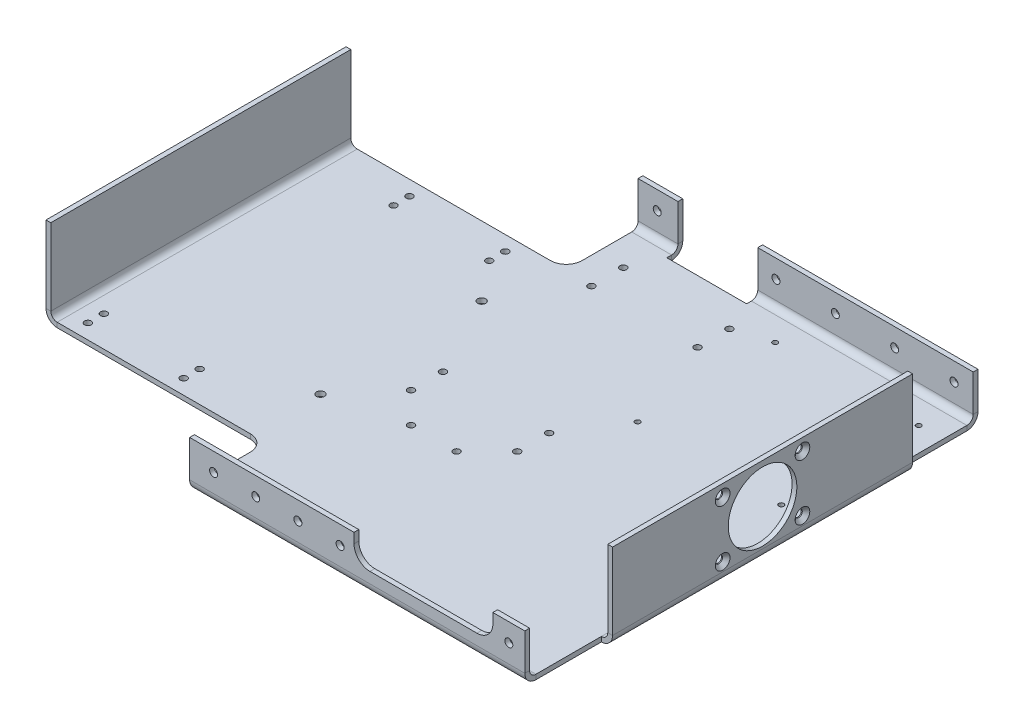
from build123d import *

# Parameters (mm, degrees)
SKETCH1_W                                            = 355
SKETCH1_H                                            = 188
BOSS_EXTRUDE1_DEPTH                                  = 3
EDGE_FLANGE1_STRIP_W                                 = 20
EDGE_FLANGE1_STRIP_H                                 = 3
EDGE_FLANGE1_STRIP_CUT_DEPTH                         = 188
EDGE_FLANGE1_DEPTH                                   = 188
SKETCH11_R                                           = 21.5
CUT_EXTRUDE2_DEPTH                                   = 10
CSK_FOR_M4_HEX_SOCKET_COUNTERSUNK_HEAD_S_D           = 4.5
CSK_FOR_M4_HEX_SOCKET_COUNTERSUNK_HEAD_S_DEPTH       = 10
CSK_FOR_M4_HEX_SOCKET_COUNTERSUNK_HEAD_S_CSINK_D     = 9.18
CSK_FOR_M4_HEX_SOCKET_COUNTERSUNK_HEAD_S_CSINK_ANGLE = 90
CSK_FOR_M4_HEX_SOCKET_COUNTERSUNK_HEAD_S_TIP         = 1.351936393
EDGE_FLANGE2_STRIP_W                                 = 20
EDGE_FLANGE2_STRIP_H                                 = 3
EDGE_FLANGE2_STRIP_CUT_DEPTH                         = 188
EDGE_FLANGE2_DEPTH                                   = 188
SKETCH19_W                                           = 210
SKETCH19_H                                           = 48
BOSS_EXTRUDE2_DEPTH                                  = 3
FILLET1_R                                            = 10
EDGE_FLANGE3_STRIP_W                                 = 20
EDGE_FLANGE3_STRIP_H                                 = 3
EDGE_FLANGE3_STRIP_CUT_DEPTH                         = 210
EDGE_FLANGE3_STRIP_2_W                               = 20
EDGE_FLANGE3_STRIP_2_H                               = 3
EDGE_FLANGE3_STRIP_CUT_2_DEPTH                       = 210
EDGE_FLANGE3_DEPTH                                   = 210
EDGE_FLANGE3_BEND_DEPTH                              = 210
SKETCH26_R                                           = 2.1
CUT_EXTRUDE3_DEPTH                                   = 10
SKETCH28_W                                           = 50
SKETCH28_H                                           = 30
CUT_EXTRUDE4_DEPTH                                   = 10
SKETCH29_W                                           = 87
SKETCH29_H                                           = 23.35234987
CUT_EXTRUDE5_DEPTH                                   = 10
FILLET2_R                                            = 10
SKETCH30_R                                           = 2.5
SKETCH30_R_2                                         = 1.57499812
CUT_EXTRUDE6_DEPTH                                   = 10
SKETCH31_R                                           = 2.1
CUT_EXTRUDE7_DEPTH                                   = 236
SKETCH32_R                                           = 2.5
CUT_EXTRUDE8_DEPTH                                   = 10
SKETCH33_R                                           = 2.5
CUT_EXTRUDE9_DEPTH                                   = 10


# Sheet-metal steps are written as plain solids
with BuildPart() as part:
    # Sketch1 → Boss-Extrude1 (new body)
    with BuildSketch(Plane(origin=(0, 0, 0), x_dir=(1, 0, 0), z_dir=(0, 1, 0))):
        Rectangle(SKETCH1_W, SKETCH1_H)
    extrude(amount=BOSS_EXTRUDE1_DEPTH)

    # Edge-Flange1 strip (across the edge) → Edge-Flange1 strip cut (cut)
    with BuildSketch(Plane(origin=(177.5, 3, 94), x_dir=(-1, 0, 0), z_dir=(0, 0, -1))):
        with Locations((-3, -1.5)):
            Rectangle(EDGE_FLANGE1_STRIP_W, EDGE_FLANGE1_STRIP_H)
    extrude(amount=EDGE_FLANGE1_STRIP_CUT_DEPTH, mode=Mode.SUBTRACT)

    # Edge-Flange1 section (across the edge) → Edge-Flange1 (add)
    with BuildSketch(Plane(origin=(177.5, 3, 94), x_dir=(-1, 0, 0), z_dir=(0, 0, -1))):
        with BuildLine():
            Line((0, 4), (0, 52))
            Line((0, 52), (3, 52))
            Line((3, 52), (3, 4))
            ThreePointArc((3, 4), (4.171572875, 1.171572875), (7, 0))
            Line((7, 0), (7, -3))
            ThreePointArc((7, -3), (2.050252532, -0.949747468), (0, 4))
        make_face()
    extrude(amount=EDGE_FLANGE1_DEPTH)

    # Sketch11 → Cut-Extrude2 (cut)
    with BuildSketch(Plane.ZY.offset(-174.5)):
        with Locations(Location((0, 30, 0), (0, 0, 270))):
            Circle(SKETCH11_R)
    extrude(amount=-CUT_EXTRUDE2_DEPTH, mode=Mode.SUBTRACT)

    # CSK for M4 Hex Socket Countersunk Head Screw1
    with Locations(Plane(origin=(177.5, 0, 0), x_dir=(0, 0, -1), z_dir=(1, 0, 0))):
        with Locations((-25, 47.5), (25, 47.5), (25, 12.5), (-25, 12.5)):
            CounterSinkHole(CSK_FOR_M4_HEX_SOCKET_COUNTERSUNK_HEAD_S_D / 2, CSK_FOR_M4_HEX_SOCKET_COUNTERSUNK_HEAD_S_CSINK_D / 2, depth=CSK_FOR_M4_HEX_SOCKET_COUNTERSUNK_HEAD_S_DEPTH, counter_sink_angle=CSK_FOR_M4_HEX_SOCKET_COUNTERSUNK_HEAD_S_CSINK_ANGLE)
            with Locations((0, 0, -(CSK_FOR_M4_HEX_SOCKET_COUNTERSUNK_HEAD_S_DEPTH + CSK_FOR_M4_HEX_SOCKET_COUNTERSUNK_HEAD_S_TIP / 2))):  # 118° drill point
                Cone(0, CSK_FOR_M4_HEX_SOCKET_COUNTERSUNK_HEAD_S_D / 2, CSK_FOR_M4_HEX_SOCKET_COUNTERSUNK_HEAD_S_TIP, mode=Mode.SUBTRACT)

    # Edge-Flange2 strip (across the edge) → Edge-Flange2 strip cut (cut)
    with BuildSketch(Plane(origin=(-177.5, 3, -94), x_dir=(1, 0, 0), z_dir=(0, 0, 1))):
        with Locations((-3, -1.5)):
            Rectangle(EDGE_FLANGE2_STRIP_W, EDGE_FLANGE2_STRIP_H)
    extrude(amount=EDGE_FLANGE2_STRIP_CUT_DEPTH, mode=Mode.SUBTRACT)

    # Edge-Flange2 section (across the edge) → Edge-Flange2 (add)
    with BuildSketch(Plane(origin=(-177.5, 3, -94), x_dir=(1, 0, 0), z_dir=(0, 0, 1))):
        with BuildLine():
            Line((0, 4), (0, 52))
            Line((0, 52), (3, 52))
            Line((3, 52), (3, 4))
            ThreePointArc((3, 4), (4.171572875, 1.171572875), (7, 0))
            Line((7, 0), (7, -3))
            ThreePointArc((7, -3), (2.050252532, -0.949747468), (0, 4))
        make_face()
    extrude(amount=EDGE_FLANGE2_DEPTH)

    # Sketch19 → Boss-Extrude2 (add)
    with BuildSketch(Plane(origin=(0, 3, 0), x_dir=(1, 0, 0), z_dir=(0, 1, 0))):
        with Locations((65.5, 118)):
            Rectangle(SKETCH19_W, SKETCH19_H)
        with Locations((65.5, -118)):
            Rectangle(SKETCH19_W, SKETCH19_H)
    extrude(amount=-BOSS_EXTRUDE2_DEPTH)

    # Fillet1
    fillet1_edges = [part.edges().sort_by_distance(p)[0] for p in [
        (-39.5, 1.5, -94),
        (-39.5, 1.5, 94),
    ]]
    fillet(fillet1_edges, radius=FILLET1_R)

    # Edge-Flange3 strip (across the edge) → Edge-Flange3 strip cut (cut)
    with BuildSketch(Plane(origin=(170.5, 3, -142), x_dir=(0, 0, 1), z_dir=(-1, 0, 0))):
        with Locations((-3, -1.5)):
            Rectangle(EDGE_FLANGE3_STRIP_W, EDGE_FLANGE3_STRIP_H)
    extrude(amount=EDGE_FLANGE3_STRIP_CUT_DEPTH, mode=Mode.SUBTRACT)

    # Edge-Flange3 strip 2 (across the edge) → Edge-Flange3 strip cut 2 (cut)
    with BuildSketch(Plane(origin=(-39.5, 3, 142), x_dir=(0, 0, -1), z_dir=(1, 0, 0))):
        with Locations((-3, -1.5)):
            Rectangle(EDGE_FLANGE3_STRIP_2_W, EDGE_FLANGE3_STRIP_2_H)
    extrude(amount=EDGE_FLANGE3_STRIP_CUT_2_DEPTH, mode=Mode.SUBTRACT)

    # Edge-Flange3 section (across the edge) → Edge-Flange3 (add)
    with BuildSketch(Plane(origin=(170.5, 3, -142), x_dir=(0, 0, 1), z_dir=(-1, 0, 0))):
        with BuildLine():
            Line((0, 4), (0, 27))
            Line((0, 27), (3, 27))
            Line((3, 27), (3, 4))
            ThreePointArc((3, 4), (4.171572875, 1.171572875), (7, 0))
            Line((7, 0), (7, -3))
            ThreePointArc((7, -3), (2.050252532, -0.949747468), (0, 4))
        make_face()
    extrude(amount=EDGE_FLANGE3_DEPTH)

    # Edge-Flange3 section 2 (across the edge) → Edge-Flange3 bend (add)
    with BuildSketch(Plane(origin=(-39.5, 3, 142), x_dir=(0, 0, -1), z_dir=(1, 0, 0))):
        with BuildLine():
            Line((0, 4), (0, 27))
            Line((0, 27), (3, 27))
            Line((3, 27), (3, 4))
            ThreePointArc((3, 4), (4.171572875, 1.171572875), (7, 0))
            Line((7, 0), (7, -3))
            ThreePointArc((7, -3), (2.050252532, -0.949747468), (0, 4))
        make_face()
    extrude(amount=EDGE_FLANGE3_BEND_DEPTH)

    # Sketch26 → Cut-Extrude3 (cut)
    with BuildSketch(Plane(origin=(0, 0, 0), x_dir=(-1, 0, 0), z_dir=(0, -1, 0))):
        with Locations(Location((160.5, -74.75, 0), (0, 0, 90))):
            Circle(SKETCH26_R)
        with Locations(Location((160.5, -84.75, 0), (0, 0, 90))):
            Circle(SKETCH26_R)
        with Locations(Location((100.5, -84.75, 0), (0, 0, 90))):
            Circle(SKETCH26_R)
        with Locations(Location((100.5, -74.75, 0), (0, 0, 90))):
            Circle(SKETCH26_R)
        with Locations(Location((128.5, 74.75, 0), (0, 0, 90))):
            Circle(SKETCH26_R)
        with Locations(Location((128.5, 84.75, 0), (0, 0, 90))):
            Circle(SKETCH26_R)
        with Locations(Location((68.5, 74.75, 0), (0, 0, 90))):
            Circle(SKETCH26_R)
        with Locations(Location((68.5, 84.75, 0), (0, 0, 90))):
            Circle(SKETCH26_R)
    extrude(amount=-CUT_EXTRUDE3_DEPTH, mode=Mode.SUBTRACT)

    # Sketch28 → Cut-Extrude4 (cut)
    with BuildSketch(Plane(origin=(0, 0, -142), x_dir=(-1, 0, 0), z_dir=(0, 0, -1))):
        with Locations((-10.5, 15)):
            Rectangle(SKETCH28_W, SKETCH28_H)
    extrude(amount=-CUT_EXTRUDE4_DEPTH, mode=Mode.SUBTRACT)

    # Sketch29 → Cut-Extrude5 (cut)
    with BuildSketch(Plane.XY.offset(142)):
        with Locations((107, 25.461076577)):
            Rectangle(SKETCH29_W, SKETCH29_H)
    extrude(amount=-CUT_EXTRUDE5_DEPTH, mode=Mode.SUBTRACT)

    # Fillet2
    fillet2_edges = [part.edges().sort_by_distance(p)[0] for p in [
        (63.5, 13.784901642, 140.5),
        (150.5, 13.784901642, 140.5),
    ]]
    fillet(fillet2_edges, radius=FILLET2_R)

    # Sketch30 → Cut-Extrude6 (cut)
    with BuildSketch(Plane(origin=(0, 0, 0), x_dir=(-1, 0, 0), z_dir=(0, -1, 0))):
        with Locations(Location((49.000000561, -50.5, 0), (0, 0, 90))):
            Circle(SKETCH30_R)
        with Locations(Location((49.000000561, 50.5, 0), (0, 0, 90))):
            Circle(SKETCH30_R)
        with Locations(Location((-65.4184, 33.8046, 0), (0, 0, 90))):
            Circle(SKETCH30_R_2)
        with Locations(Location((-155.436, 33.8046, 0), (0, 0, 90))):
            Circle(SKETCH30_R_2)
        with Locations(Location((-155.43961696, 119.9106, 0), (0, 0, 90))):
            Circle(SKETCH30_R_2)
        with Locations(Location((-65.42201696, 119.9614, 0), (0, 0, 90))):
            Circle(SKETCH30_R_2)
    extrude(amount=-CUT_EXTRUDE6_DEPTH, mode=Mode.SUBTRACT)

    # Sketch31 → Cut-Extrude7 (cut)
    with BuildSketch(Plane(origin=(0, 3, 0), x_dir=(1, 0, 0), z_dir=(0, 1, 0))):
        with Locations(Location((-22.75, 113, 0), (0, 0, 270))):
            Circle(SKETCH31_R)
        with Locations(Location((-22.75, 93, 0), (0, 0, 270))):
            Circle(SKETCH31_R)
        with Locations(Location((43.75, 113, 0), (0, 0, 270))):
            Circle(SKETCH31_R)
        with Locations(Location((43.75, 93, 0), (0, 0, 270))):
            Circle(SKETCH31_R)
        with Locations(Location((43.75, 0, 0), (0, 0, 270))):
            Circle(SKETCH31_R)
        with Locations(Location((43.75, -20, 0), (0, 0, 270))):
            Circle(SKETCH31_R)
        with Locations(Location((-3.75, -39, 0), (0, 0, 270))):
            Circle(SKETCH31_R)
        with Locations(Location((24.75, -39, 0), (0, 0, 270))):
            Circle(SKETCH31_R)
        with Locations(Location((-22.75, 0, 0), (0, 0, 270))):
            Circle(SKETCH31_R)
        with Locations(Location((-22.75, -20, 0), (0, 0, 270))):
            Circle(SKETCH31_R)
    extrude(amount=-CUT_EXTRUDE7_DEPTH, mode=Mode.SUBTRACT)

    # Sketch32 → Cut-Extrude8 (cut)
    with BuildSketch(Plane.XY.offset(142)):
        with Locations((-24.5, 18.5)):
            Circle(SKETCH32_R)
        with Locations((1.928571429, 18.5)):
            Circle(SKETCH32_R)
        with Locations((28.357142857, 18.5)):
            Circle(SKETCH32_R)
        with Locations((54.785714286, 18.5)):
            Circle(SKETCH32_R)
        with Locations((160.5, 18.5)):
            Circle(SKETCH32_R)
    extrude(amount=-CUT_EXTRUDE8_DEPTH, mode=Mode.SUBTRACT)

    # Sketch33 → Cut-Extrude9 (cut)
    with BuildSketch(Plane(origin=(0, 0, -142), x_dir=(-1, 0, 0), z_dir=(0, 0, -1))):
        with Locations((-158.5, 18.5)):
            Circle(SKETCH33_R)
        with Locations((-121.3, 18.5)):
            Circle(SKETCH33_R)
        with Locations((-84.1, 18.5)):
            Circle(SKETCH33_R)
        with Locations((-46.9, 18.5)):
            Circle(SKETCH33_R)
        with Locations((27.5, 18.5)):
            Circle(SKETCH33_R)
    extrude(amount=-CUT_EXTRUDE9_DEPTH, mode=Mode.SUBTRACT)


solid = part.part
